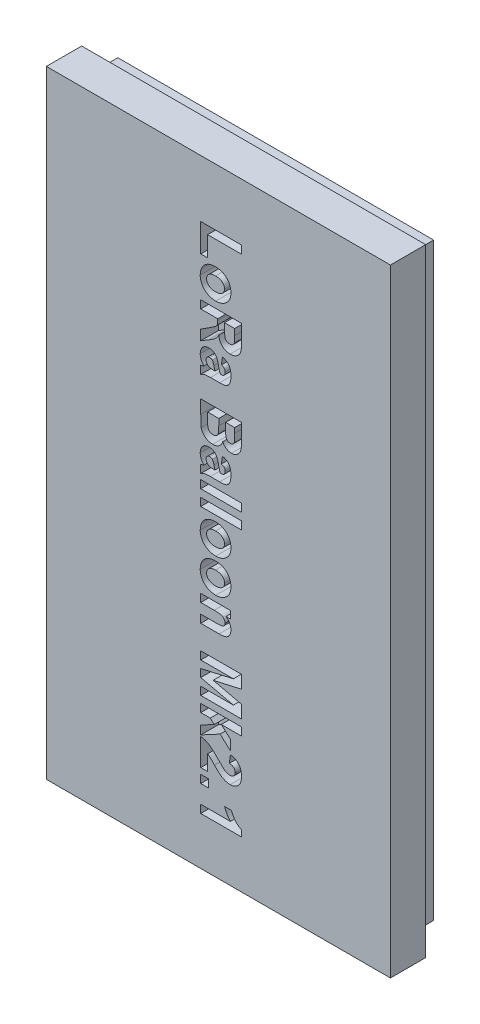
from build123d import *

# Parameters (mm, degrees)
SKETCH1_W           = 39
SKETCH1_H           = 70
BOSS_EXTRUDE1_DEPTH = 4
SKETCH2_W           = 35.8
SKETCH2_H           = 66.8
SKETCH2_W_2         = 32.2
SKETCH2_H_2         = 63.2
BOSS_EXTRUDE2_DEPTH = 2.5
SKETCH3_W           = 4.622973633
SKETCH3_H           = 0.90057928
SKETCH3_H_2         = 0.900579279
SKETCH3_W_2         = 0.900579279
CUT_EXTRUDE1_DEPTH  = 2


with BuildPart() as part:
    # Sketch1 → Boss-Extrude1 (new body)
    with BuildSketch(Plane.XY):
        with Locations((19.5, 35)):
            Rectangle(SKETCH1_W, SKETCH1_H)
    extrude(amount=BOSS_EXTRUDE1_DEPTH)

    # Sketch2 → Boss-Extrude2 (add)
    with BuildSketch(Plane(origin=(0, 0, 0), x_dir=(-1, 0, 0), z_dir=(0, 0, -1))):
        with Locations((-19.5, 35)):
            Rectangle(SKETCH2_W, SKETCH2_H)
        with Locations((-19.5, 35)):
            Rectangle(SKETCH2_W_2, SKETCH2_H_2, mode=Mode.SUBTRACT)
    extrude(amount=BOSS_EXTRUDE2_DEPTH)

    # Sketch3 → Cut-Extrude1 (cut)
    # profile 1 of 16: a face of its own
    with BuildSketch(Plane.XY.offset(4)):
        Polygon((17.5, 63.519691051), (22.122973633, 63.519691051), (22.122973633, 62.619111772), (18.280502042, 62.619111772), (18.280502042, 60.337644265), (17.5, 60.337644265), align=None)
    # profile 2 of 16: a face of its own
    with BuildSketch(Plane.XY.offset(4)):
        with BuildLine():
            add(Edge.make_bspline(
                [(19.227986492, 59.917373935), (19.268340591, 59.916553667), (19.348241235, 59.914929545), (19.466831788, 59.904980589), (19.582597294, 59.885571908), (19.695714536, 59.860482277), (19.806416527, 59.82895916), (19.913363069, 59.787668503), (20.018572563, 59.741561532), (20.119538873, 59.686551332), (20.216642118, 59.627238007), (20.307982668, 59.562480077), (20.392270804, 59.492505889), (20.471764649, 59.420003428), (20.542963196, 59.340819709), (20.610173753, 59.25914226), (20.668761487, 59.17106248), (20.722741328, 59.080281515), (20.769340893, 58.984958843), (20.810963092, 58.887212626), (20.84421655, 58.785501626), (20.874003462, 58.682243794), (20.895076066, 58.575124144), (20.911226693, 58.46559476), (20.920807626, 58.352789526), (20.921733394, 58.276648926), (20.922201261, 58.23816882)],
                knots=[0, 0, 0, 0, 1.087797627, 2.153826546, 3.204146119, 4.249074796, 5.276002369, 6.302929943, 7.33671768, 8.369955531, 9.399197913, 10.402506754, 11.384561342, 12.350717656, 13.299250364, 14.252266119, 15.199037181, 16.147307724, 17.097187567, 18.056740571, 19.008264324, 19.97962709, 20.951574749, 21.948063114, 22.962987564, 24, 24, 24, 24], degree=3))
            add(Edge.make_bspline(
                [(20.922201261, 58.23816882), (20.920492435, 58.17431076), (20.917163302, 58.049902547), (20.89380331, 57.868435741), (20.853287611, 57.69781183), (20.797267351, 57.536975467), (20.72326136, 57.38733444), (20.634810544, 57.247019053), (20.529143938, 57.117967528), (20.40795289, 57.001818049), (20.277240101, 56.897040623), (20.139130934, 56.806096419), (19.996080966, 56.728621147), (19.847473094, 56.665454644), (19.693540221, 56.615077456), (19.533372162, 56.581373883), (19.368435672, 56.5582934), (19.256523789, 56.556247491), (19.199843389, 56.555211293)],
                knots=[0, 0, 0, 0, 1.136040707, 2.213233445, 3.248238065, 4.25119704, 5.236487175, 6.211911138, 7.196384178, 8.195725979, 9.1931767, 10.173001403, 11.133846892, 12.083513917, 13.042376269, 14.010298635, 14.992269034, 16, 16, 16, 16], degree=3))
            add(Edge.make_bspline(
                [(19.199843389, 56.555211293), (19.157599655, 56.555892607), (19.0738988, 56.557242549), (18.949923499, 56.569225625), (18.828866965, 56.586435452), (18.710806659, 56.612233079), (18.595913097, 56.644512826), (18.484212787, 56.68553559), (18.375843769, 56.733219222), (18.270645012, 56.787374854), (18.171228883, 56.848385325), (18.076479739, 56.912829759), (17.989613644, 56.983498286), (17.908343846, 57.057930632), (17.833120613, 57.136653742), (17.764474284, 57.22039727), (17.702322369, 57.308790164), (17.647348245, 57.401571301), (17.598380596, 57.497418925), (17.556075444, 57.596143647), (17.52061437, 57.69714263), (17.49154767, 57.800282717), (17.4673821, 57.905319168), (17.452433072, 58.013337566), (17.441007522, 58.123164342), (17.440311587, 58.197173674), (17.439961381, 58.234416407)],
                knots=[0, 0, 0, 0, 1.117558833, 2.214307803, 3.293244786, 4.351421184, 5.409597582, 6.448807362, 7.497331125, 8.540978692, 9.576922014, 10.582241184, 11.570837346, 12.537122916, 13.496974449, 14.449450387, 15.399839374, 16.353464778, 17.300823134, 18.246083241, 19.193441597, 20.131138339, 21.080698472, 22.042616426, 23.015011865, 24, 24, 24, 24], degree=3))
            add(Edge.make_bspline(
                [(17.439961381, 58.234416407), (17.441434818, 58.293581477), (17.444329398, 58.409811804), (17.466190044, 58.580403837), (17.502637169, 58.743113282), (17.553836141, 58.89819662), (17.618260134, 59.046016275), (17.698440035, 59.185734774), (17.79447105, 59.316576164), (17.902499007, 59.440250702), (18.024251963, 59.553385074), (18.159878703, 59.651084335), (18.308067385, 59.733312239), (18.468125433, 59.800916368), (18.640780217, 59.853364958), (18.825794291, 59.890561403), (19.022910429, 59.913321598), (19.158504181, 59.916000953), (19.227986492, 59.917373935)],
                knots=[0, 0, 0, 0, 1.024594995, 2.012826322, 2.973358778, 3.908543225, 4.837401023, 5.761810751, 6.69243552, 7.644223827, 8.602462928, 9.564551743, 10.532007457, 11.531954493, 12.568505162, 13.651979317, 14.796803673, 16, 16, 16, 16], degree=3))
        make_face()
        with BuildLine():
            add(Edge.make_bspline(
                [(19.181081321, 59.016794656), (19.140418132, 59.015985767), (19.061457429, 59.014415049), (18.946509384, 59.004834622), (18.839622498, 58.985121553), (18.739486697, 58.962179728), (18.647961982, 58.928237045), (18.563118232, 58.889661344), (18.486368037, 58.842211129), (18.418159022, 58.787894592), (18.358227437, 58.728430958), (18.305063926, 58.666277416), (18.260023454, 58.601076499), (18.223835025, 58.532291004), (18.195763008, 58.46081815), (18.174765469, 58.386120438), (18.162389452, 58.308317825), (18.161082475, 58.255410656), (18.160424805, 58.228787786)],
                knots=[0, 0, 0, 0, 1.347985487, 2.617548842, 3.817114289, 4.948286482, 6.017057593, 7.046407217, 8.032969353, 8.999289909, 9.930051738, 10.827140183, 11.706817169, 12.550594062, 13.397420762, 14.247349517, 15.118066881, 16, 16, 16, 16], degree=3))
            add(Edge.make_bspline(
                [(18.160424805, 58.228787786), (18.161082172, 58.202789107), (18.162388524, 58.151123318), (18.174768649, 58.075184814), (18.195758212, 58.002347429), (18.224167513, 57.93213144), (18.260561859, 57.864498818), (18.306359128, 57.800600759), (18.359147439, 57.739085743), (18.42010437, 57.68129455), (18.488357165, 57.627164406), (18.565874129, 57.581398416), (18.650982245, 57.542984668), (18.743354127, 57.51120928), (18.843361939, 57.485665346), (18.951359004, 57.468256351), (19.067059726, 57.458032174), (19.146662829, 57.456552441), (19.187648045, 57.455790572)],
                knots=[0, 0, 0, 0, 0.86498205, 1.718932724, 2.552529207, 3.383717481, 4.236080589, 5.102502034, 5.995588818, 6.930639414, 7.894730959, 8.889086482, 9.918564038, 10.998334367, 12.1369617, 13.350269694, 14.635734454, 16, 16, 16, 16], degree=3))
            add(Edge.make_bspline(
                [(19.187648045, 57.455790572), (19.227688932, 57.456588782), (19.305407142, 57.458138086), (19.418448526, 57.467853118), (19.523973479, 57.487150925), (19.622320571, 57.511914829), (19.713524667, 57.543985128), (19.797316766, 57.58327715), (19.873991238, 57.630272105), (19.942107737, 57.685034462), (20.003044034, 57.743795675), (20.055828048, 57.806243808), (20.101619145, 57.87108965), (20.138009283, 57.939653741), (20.166408615, 58.010806032), (20.187393837, 58.084578407), (20.199774112, 58.161447567), (20.201080471, 58.21373417), (20.201737837, 58.240045027)],
                knots=[0, 0, 0, 0, 1.337232047, 2.595528913, 3.783536199, 4.915617704, 5.97906533, 7.006690339, 8.000659516, 8.974235141, 9.919454987, 10.823278711, 11.700968276, 12.565199868, 13.408680491, 14.254935835, 15.121875735, 16, 16, 16, 16], degree=3))
            add(Edge.make_bspline(
                [(20.201737837, 58.240045027), (20.201125638, 58.266363218), (20.199923414, 58.318046388), (20.187117275, 58.394207937), (20.1666105, 58.467170456), (20.137959369, 58.53762355), (20.10165055, 58.605310335), (20.055496899, 58.669222471), (20.003354012, 58.731596732), (19.942036507, 58.789412202), (19.873587127, 58.843503766), (19.796542842, 58.889985729), (19.712370979, 58.929796557), (19.620397249, 58.961484494), (19.521262796, 58.98667956), (19.414268616, 59.004448634), (19.300102491, 59.014500587), (19.221439565, 59.016016772), (19.181081321, 59.016794656)],
                knots=[0, 0, 0, 0, 0.8777483, 1.723705717, 2.56959874, 3.403036217, 4.257705828, 5.126471818, 6.029908573, 6.967489424, 7.934189811, 8.936630112, 9.963815147, 11.036651848, 12.178360317, 13.374360467, 14.652907978, 16, 16, 16, 16], degree=3))
        make_face(mode=Mode.SUBTRACT)
    # profile 3 of 16: a face of its own
    with BuildSketch(Plane.XY.offset(4)):
        with BuildLine():
            Line((17.5, 55.834747869), (22.122973633, 55.834747869))
            Line((22.122973633, 55.834747869), (22.122973633, 53.931336039))
            add(Edge.make_bspline(
                [(22.122973633, 53.931336039), (22.122603462, 53.872546069), (22.121890503, 53.759314846), (22.116763364, 53.595968956), (22.105883787, 53.445890968), (22.093695487, 53.308683291), (22.075788291, 53.184747794), (22.054389036, 53.07355638), (22.02973767, 52.975250916), (21.991190656, 52.86232027), (21.927918547, 52.73590191), (21.829831137, 52.599074998), (21.709116511, 52.475953385), (21.591346034, 52.386968918), (21.487257539, 52.325280846), (21.404923358, 52.283439484), (21.317857299, 52.250098354), (21.227356033, 52.221689731), (21.133020602, 52.199279165), (21.034598303, 52.183293809), (20.932711672, 52.173783072), (20.863433738, 52.17285937), (20.828390919, 52.172392134)],
                knots=[0, 0, 0, 0, 1.403336213, 2.702867097, 3.89994726, 4.994709233, 5.990128961, 6.887471613, 7.696701944, 8.407207329, 9.732421867, 11.053910544, 12.410433107, 13.833109191, 14.562763883, 15.297137368, 16.03453921, 16.78526912, 17.560138056, 18.346710252, 19.163717375, 20, 20, 20, 20], degree=3))
            add(Edge.make_bspline(
                [(20.828390919, 52.172392134), (20.784249276, 52.173152122), (20.697885971, 52.17463904), (20.571821786, 52.19038499), (20.45195708, 52.21403639), (20.339297604, 52.249508681), (20.231984451, 52.291952276), (20.132497639, 52.347135765), (20.039105913, 52.411113631), (19.952432097, 52.48444969), (19.87351831, 52.567423037), (19.802330467, 52.658794234), (19.737810759, 52.757581763), (19.682936532, 52.865615406), (19.633581682, 52.98093702), (19.593807931, 53.105487545), (19.560681473, 53.237717693), (19.545373295, 53.32925955), (19.537560619, 53.375978817)],
                knots=[0, 0, 0, 0, 1.084141299, 2.12112686, 3.117250271, 4.082180618, 5.019674211, 5.948149429, 6.871043381, 7.797863675, 8.732676681, 9.679570512, 10.640822351, 11.627176691, 12.653315453, 13.72007994, 14.836420889, 16, 16, 16, 16], degree=3))
            add(Edge.make_bspline(
                [(19.537560619, 53.375978817), (19.508484087, 53.327420021), (19.451853997, 53.232845847), (19.358336472, 53.100939278), (19.261317569, 52.981707751), (19.174212653, 52.890871561), (19.097310292, 52.821625001), (19.0295238, 52.766448195), (18.951540268, 52.707420675), (18.862838653, 52.644481945), (18.763722605, 52.577189453), (18.653874446, 52.505987708), (18.533375015, 52.430769254), (18.449117336, 52.379912075), (18.405269796, 52.353446093)],
                knots=[0, 0, 0, 0, 1.316447784, 2.563942512, 3.758196669, 4.89017242, 5.487731481, 6.164970468, 6.923081098, 7.76291089, 8.695186333, 9.710230341, 10.808408125, 12, 12, 12, 12], degree=3))
            Line((18.405269796, 52.353446093), (17.5, 51.812160423))
            Line((17.5, 51.812160423), (17.5, 52.95383228))
            Line((17.5, 52.95383228), (18.495327724, 53.594556913))
            add(Edge.make_bspline(
                [(18.495327724, 53.594556913), (18.538170903, 53.622381996), (18.619855584, 53.675433219), (18.736113095, 53.751052306), (18.839709613, 53.820173631), (18.931509766, 53.880939595), (19.009413932, 53.937271757), (19.075916224, 53.984397728), (19.12987976, 54.024862821), (19.184272621, 54.068912267), (19.238866246, 54.121356183), (19.293796286, 54.18457256), (19.336920929, 54.250578408), (19.370530988, 54.321019242), (19.39451614, 54.403545626), (19.410428062, 54.503019432), (19.418952624, 54.622883951), (19.420435996, 54.709323008), (19.421235795, 54.755928941)],
                knots=[0, 0, 0, 0, 1.540630534, 2.937361724, 4.182336204, 5.296545873, 6.256860607, 7.081241145, 7.754565199, 8.290682583, 9.191113071, 10.033949391, 10.810788607, 11.561665679, 12.379113064, 13.39303176, 14.594383257, 16, 16, 16, 16], degree=3))
            Line((19.421235795, 54.755928941), (19.421235795, 54.93416859))
            Line((19.421235795, 54.93416859), (17.5, 54.93416859))
            Line((17.5, 54.93416859), (17.5, 55.834747869))
        make_face()
        with BuildLine():
            Line((20.201737837, 54.93416859), (20.201737837, 54.273743786))
            add(Edge.make_bspline(
                [(20.201737837, 54.273743786), (20.201999563, 54.225587847), (20.20249754, 54.133962899), (20.203997976, 54.003230593), (20.207918581, 53.886279269), (20.212519213, 53.783074596), (20.217812844, 53.693574506), (20.224943188, 53.617787775), (20.23420104, 53.555806365), (20.24734485, 53.49201719), (20.271407064, 53.424655662), (20.311858966, 53.353327902), (20.361639607, 53.288286701), (20.424349944, 53.232785424), (20.498156922, 53.186888836), (20.583996569, 53.155374934), (20.680596319, 53.136459226), (20.748558268, 53.134198807), (20.784300059, 53.133010032)],
                knots=[0, 0, 0, 0, 1.560937284, 2.96995135, 4.237567709, 5.353650601, 6.318464703, 7.143454388, 7.820048429, 8.348858403, 9.25293029, 10.124191563, 10.998043079, 11.895328271, 12.823620657, 13.798761283, 14.842349086, 16, 16, 16, 16], degree=3))
            add(Edge.make_bspline(
                [(20.784300059, 53.133010032), (20.81847221, 53.134245883), (20.883936766, 53.136613436), (20.976941065, 53.155158092), (21.059506611, 53.187182262), (21.130758936, 53.23301968), (21.191421011, 53.289971409), (21.24112854, 53.356768373), (21.282982152, 53.431399448), (21.299994907, 53.486582477), (21.308699868, 53.514818122)],
                knots=[0, 0, 0, 0, 1.164311867, 2.230505154, 3.21629184, 4.165493112, 5.100643873, 6.036584124, 6.995373831, 8, 8, 8, 8], degree=3))
            add(Edge.make_bspline(
                [(21.308699868, 53.514818122), (21.311320199, 53.527617067), (21.317551044, 53.558051486), (21.324877556, 53.611570435), (21.329832618, 53.679873062), (21.334583807, 53.762748434), (21.338086886, 53.860333551), (21.341182461, 53.972906446), (21.341427788, 54.100196665), (21.342111742, 54.189940649), (21.342471591, 54.237157752)],
                knots=[0, 0, 0, 0, 0.432971861, 1.029557334, 1.788740938, 2.702316591, 3.781055348, 5.025222918, 6.434877167, 8, 8, 8, 8], degree=3))
            Line((21.342471591, 54.237157752), (21.342471591, 54.93416859))
            Line((21.342471591, 54.93416859), (20.201737837, 54.93416859))
        make_face(mode=Mode.SUBTRACT)
    # profile 4 of 16: a face of its own
    with BuildSketch(Plane.XY.offset(4)):
        with BuildLine():
            Line((19.841506126, 50.61138805), (19.961583363, 51.451928711))
            add(Edge.make_bspline(
                [(19.961583363, 51.451928711), (20.003056427, 51.440020111), (20.08373433, 51.416854211), (20.198162111, 51.373136266), (20.30438426, 51.325709527), (20.401073835, 51.270902191), (20.489620864, 51.211489282), (20.568113139, 51.144980211), (20.637964286, 51.07344571), (20.699606916, 50.99601388), (20.752828321, 50.910954703), (20.798705368, 50.817942481), (20.837141958, 50.716108782), (20.867740873, 50.60578658), (20.892075182, 50.486988816), (20.909807303, 50.359486045), (20.919932697, 50.223177629), (20.921430674, 50.129532389), (20.922201261, 50.081359621)],
                knots=[0, 0, 0, 0, 1.125515524, 2.189474865, 3.193709533, 4.158305409, 5.086274303, 5.972285183, 6.837881566, 7.691743787, 8.549806887, 9.451203831, 10.393874208, 11.385866739, 12.435713252, 13.556277782, 14.742906037, 16, 16, 16, 16], degree=3))
            add(Edge.make_bspline(
                [(20.922201261, 50.081359621), (20.921986052, 50.038506543), (20.921567926, 49.9552477), (20.914195236, 49.834230246), (20.905701633, 49.720830457), (20.891648419, 49.615270623), (20.872802431, 49.517635474), (20.850656262, 49.42762641), (20.824366297, 49.345482), (20.785361186, 49.248588079), (20.72686919, 49.141789781), (20.645227411, 49.029792983), (20.550150903, 48.93865795), (20.460504459, 48.877402987), (20.378336951, 48.83955966), (20.305144759, 48.816000272), (20.220833774, 48.79526852), (20.12519058, 48.778860098), (20.01811083, 48.765903154), (19.899799318, 48.756781831), (19.770265296, 48.75115149), (19.680158536, 48.750519763), (19.633247167, 48.750190874)],
                knots=[0, 0, 0, 0, 1.172645795, 2.278322549, 3.317437237, 4.284552983, 5.190951134, 6.037858116, 6.820064311, 7.549551753, 8.893788561, 10.141635195, 11.328036199, 12.481663495, 13.094362176, 13.79803918, 14.582676335, 15.469136844, 16.45214095, 17.533908717, 18.716103928, 20, 20, 20, 20], degree=3))
            Line((19.633247167, 48.750190874), (18.599457203, 48.757695701))
            add(Edge.make_bspline(
                [(18.599457203, 48.757695701), (18.564435728, 48.757403719), (18.496576972, 48.756837966), (18.398330909, 48.755681196), (18.307040045, 48.750474743), (18.222621106, 48.744792865), (18.144878475, 48.739106667), (18.074326469, 48.729015709), (18.010639761, 48.719369923), (17.934153527, 48.702680168), (17.841504636, 48.67487694), (17.729923806, 48.631472915), (17.614669352, 48.576902525), (17.539082625, 48.532826305), (17.5, 48.510036399)],
                knots=[0, 0, 0, 0, 1.100960395, 2.13325684, 3.08799504, 3.974623839, 4.793377983, 5.537123068, 6.214225653, 6.817686965, 7.996461938, 9.250537039, 10.578371695, 12, 12, 12, 12], degree=3))
            Line((17.5, 48.510036399), (17.5, 49.410615678))
            Line((17.5, 49.410615678), (17.867736539, 49.520373778))
            add(Edge.make_bspline(
                [(17.867736539, 49.520373778), (17.83226304, 49.556591272), (17.763238807, 49.627063168), (17.674416477, 49.742170854), (17.599695505, 49.860344522), (17.540260444, 49.983200312), (17.494849843, 50.10999856), (17.463178517, 50.240511108), (17.443827041, 50.375032633), (17.441261018, 50.465917722), (17.439961381, 50.511949088)],
                knots=[0, 0, 0, 0, 1.094238684, 2.129166538, 3.133671034, 4.10942336, 5.070833053, 6.037377746, 7.005973528, 8, 8, 8, 8], degree=3))
            add(Edge.make_bspline(
                [(17.439961381, 50.511949088), (17.441007341, 50.549813025), (17.443061457, 50.624172367), (17.454903777, 50.733206179), (17.476538098, 50.836821689), (17.507054288, 50.934832823), (17.543951561, 51.028430924), (17.591661801, 51.116031558), (17.646964549, 51.198837941), (17.71053094, 51.275834447), (17.781922723, 51.344520407), (17.857738316, 51.406912183), (17.941277911, 51.456774609), (18.028844016, 51.500371802), (18.123266364, 51.531264195), (18.222597532, 51.555303125), (18.327631273, 51.569376344), (18.399600412, 51.571119046), (18.436227209, 51.572005948)],
                knots=[0, 0, 0, 0, 1.111028414, 2.181900458, 3.212888925, 4.21115239, 5.190734394, 6.159429897, 7.131421471, 8.108723925, 9.081883785, 10.034678926, 10.981892532, 11.929727932, 12.898727489, 13.888948844, 14.925636122, 16, 16, 16, 16], degree=3))
            add(Edge.make_bspline(
                [(18.436227209, 51.572005948), (18.482593242, 51.570570747), (18.572724924, 51.567780835), (18.703283791, 51.545991429), (18.824622959, 51.509589158), (18.936022841, 51.457337912), (19.037479655, 51.39257465), (19.129142785, 51.315722556), (19.208842276, 51.225745591), (19.267148448, 51.141322735), (19.309753926, 51.065822541), (19.338835724, 50.999600706), (19.369441505, 50.926842835), (19.396985309, 50.845322297), (19.425368881, 50.756348095), (19.452494502, 50.659084561), (19.4774731, 50.553428176), (19.493569489, 50.48038811), (19.501912689, 50.442529436)],
                knots=[0, 0, 0, 0, 1.294162278, 2.515743014, 3.684113667, 4.820865117, 5.939906549, 7.036651616, 8.149715676, 9.285662014, 9.895437351, 10.567486448, 11.303637924, 12.098932185, 12.968810962, 13.91153998, 14.917493754, 16, 16, 16, 16], degree=3))
            add(Edge.make_bspline(
                [(19.501912689, 50.442529436), (19.511407002, 50.396831191), (19.529650374, 50.309021778), (19.559131352, 50.183149311), (19.587017816, 50.068002884), (19.61413993, 49.963436659), (19.640930358, 49.869757609), (19.668501435, 49.787074691), (19.694085633, 49.714833804), (19.712787099, 49.671017361), (19.721428888, 49.650770153)],
                knots=[0, 0, 0, 0, 1.361164628, 2.615484881, 3.770095419, 4.816364149, 5.765912261, 6.610903979, 7.358110453, 8, 8, 8, 8], degree=3))
            add(Edge.make_bspline(
                [(19.721428888, 49.650770153), (19.76207844, 49.651429427), (19.835936364, 49.652627291), (19.93546068, 49.657961407), (20.012171286, 49.66950181), (20.070146149, 49.685642352), (20.113156329, 49.712229682), (20.150196809, 49.74408205), (20.18179134, 49.785492699), (20.210776693, 49.83420177), (20.234039299, 49.892955807), (20.250744994, 49.962036374), (20.259418855, 50.041742371), (20.260957962, 50.098226609), (20.261776456, 50.128264791)],
                knots=[0, 0, 0, 0, 1.704637254, 3.09722893, 4.172654963, 4.956246112, 5.596985007, 6.275246559, 6.99385986, 7.769515704, 8.645866914, 9.631493719, 10.740434052, 12, 12, 12, 12], degree=3))
            add(Edge.make_bspline(
                [(20.261776456, 50.128264791), (20.260884607, 50.159017067), (20.25919465, 50.217289276), (20.241526382, 50.299374461), (20.215410217, 50.372126763), (20.174002857, 50.43472478), (20.117664666, 50.489569205), (20.042764104, 50.536922131), (19.949087652, 50.578793394), (19.879011929, 50.60002468), (19.841506126, 50.61138805)],
                knots=[0, 0, 0, 0, 1.045871977, 1.981813381, 2.848317391, 3.663751395, 4.514929533, 5.507645304, 6.666046366, 8, 8, 8, 8], degree=3))
        make_face()
        with BuildLine():
            add(Edge.make_bspline(
                [(19.121042702, 49.650770153), (19.111478433, 49.678227344), (19.090198568, 49.739317777), (19.059474829, 49.841940313), (19.027018533, 49.965053874), (19.005193715, 50.054117219), (18.993460638, 50.101997896)],
                knots=[0, 0, 0, 0, 0.743632693, 1.654533494, 2.73907137, 4, 4, 4, 4], degree=3))
            add(Edge.make_bspline(
                [(18.993460638, 50.101997896), (18.98653897, 50.130215888), (18.97332241, 50.184096661), (18.950053418, 50.260430744), (18.928514853, 50.329717913), (18.904326783, 50.390991339), (18.881777826, 50.445420249), (18.857166421, 50.491799098), (18.832210074, 50.530622659), (18.813567384, 50.552457403), (18.804901851, 50.562606673)],
                knots=[0, 0, 0, 0, 1.388607462, 2.65147299, 3.814389992, 4.855436495, 5.799565367, 6.62877246, 7.362623276, 8, 8, 8, 8], degree=3))
            add(Edge.make_bspline(
                [(18.804901851, 50.562606673), (18.787150786, 50.579491216), (18.752087496, 50.612842884), (18.686643373, 50.646727282), (18.614581201, 50.668200293), (18.563658271, 50.670332939), (18.537542378, 50.671426669)],
                knots=[0, 0, 0, 0, 0.985740837, 1.947112291, 2.947173789, 4, 4, 4, 4], degree=3))
            add(Edge.make_bspline(
                [(18.537542378, 50.671426669), (18.50766342, 50.670137856), (18.449801672, 50.667642019), (18.366786442, 50.643682117), (18.290760217, 50.606342092), (18.224593068, 50.553149627), (18.168585191, 50.490429239), (18.129814521, 50.416483471), (18.103890852, 50.33606052), (18.101569181, 50.279194172), (18.100386186, 50.250218235)],
                knots=[0, 0, 0, 0, 1.056198986, 2.045369905, 3.036276429, 4.038084886, 5.035473036, 5.992159802, 6.976916006, 8, 8, 8, 8], degree=3))
            add(Edge.make_bspline(
                [(18.100386186, 50.250218235), (18.101736527, 50.223223501), (18.104453435, 50.16890965), (18.124157539, 50.087854462), (18.156784545, 50.007731894), (18.200051148, 49.929484378), (18.252073425, 49.8576195), (18.311090427, 49.79663157), (18.374225547, 49.747093123), (18.432190619, 49.715163813), (18.484079963, 49.69628429), (18.530121172, 49.684823766), (18.5827991, 49.672932093), (18.642798398, 49.665245914), (18.709733915, 49.658557856), (18.78390109, 49.654068826), (18.865230729, 49.651253864), (18.921849407, 49.650935466), (18.951245984, 49.650770153)],
                knots=[0, 0, 0, 0, 1.093500888, 2.200141778, 3.360346716, 4.591280596, 5.815607582, 6.94487563, 8.019710678, 9.057444999, 9.610729159, 10.253199895, 10.979011171, 11.798077413, 12.702238226, 13.705425431, 14.808650418, 16, 16, 16, 16], degree=3))
            Line((18.951245984, 49.650770153), (19.121042702, 49.650770153))
        make_face(mode=Mode.SUBTRACT)
    # profile 5 of 16: a face of its own
    with BuildSketch(Plane.XY.offset(4)):
        with BuildLine():
            Line((22.122973633, 46.108491655), (22.122973633, 44.281066201))
            add(Edge.make_bspline(
                [(22.122973633, 44.281066201), (22.122521051, 44.221026579), (22.121651102, 44.105618856), (22.117632998, 43.939162972), (22.108005759, 43.786847256), (22.095757541, 43.648294778), (22.081840746, 43.523482495), (22.061533426, 43.412540908), (22.040180572, 43.315039471), (22.0049456, 43.204537428), (21.948462842, 43.080188598), (21.859088002, 42.944827325), (21.748544411, 42.821243994), (21.640427701, 42.730695394), (21.545807025, 42.665898527), (21.471963858, 42.622291391), (21.394724771, 42.586831753), (21.315529677, 42.557950869), (21.2346417, 42.533594529), (21.150572045, 42.51855641), (21.064475175, 42.507225139), (21.006044505, 42.506526476), (20.976611259, 42.506174538)],
                knots=[0, 0, 0, 0, 1.498327689, 2.88007457, 4.154414764, 5.305986542, 6.351317343, 7.286582663, 8.11946184, 8.840080679, 10.177555878, 11.512935148, 12.872513647, 14.301275782, 15.019863751, 15.733221227, 16.438466007, 17.137161526, 17.836031326, 18.543086972, 19.26611006, 20, 20, 20, 20], degree=3))
            add(Edge.make_bspline(
                [(20.976611259, 42.506174538), (20.922946761, 42.508244761), (20.817024149, 42.512330951), (20.662821857, 42.547652419), (20.51596526, 42.603079791), (20.380113254, 42.682270405), (20.256588311, 42.778484715), (20.148778926, 42.889289753), (20.056681459, 43.012718845), (20.011500867, 43.104508485), (19.988788362, 43.150651585)],
                knots=[0, 0, 0, 0, 1.031817477, 2.036594177, 3.029254201, 4.043130586, 5.050931669, 6.034203586, 7.01178454, 8, 8, 8, 8], degree=3))
            add(Edge.make_bspline(
                [(19.988788362, 43.150651585), (19.978291223, 43.119218071), (19.957542489, 43.057086323), (19.919057509, 42.967929238), (19.874445181, 42.88431553), (19.826159834, 42.80476423), (19.770442173, 42.731859613), (19.709973461, 42.664103109), (19.645321829, 42.600321355), (19.573797837, 42.544037104), (19.499063042, 42.491579361), (19.418797393, 42.447838091), (19.335071516, 42.410185621), (19.247401209, 42.378753037), (19.155229507, 42.355750252), (19.059306459, 42.33888402), (18.959608937, 42.328333414), (18.891858621, 42.326825057), (18.857435643, 42.326058683)],
                knots=[0, 0, 0, 0, 1.053917501, 2.08318216, 3.084375989, 4.067115349, 5.039987852, 5.998256831, 6.954975631, 7.924383767, 8.890110205, 9.856297623, 10.826929889, 11.808561028, 12.814635272, 13.844956918, 14.905053061, 16, 16, 16, 16], degree=3))
            add(Edge.make_bspline(
                [(18.857435643, 42.326058683), (18.815500063, 42.327003794), (18.733295748, 42.328856452), (18.612472135, 42.342119765), (18.496620731, 42.364499356), (18.385911071, 42.396523304), (18.279951486, 42.436913818), (18.179119697, 42.486864589), (18.083315073, 42.546315283), (17.992730779, 42.613589789), (17.90919217, 42.686948542), (17.833589227, 42.76465437), (17.765489185, 42.844869725), (17.707581308, 42.930073546), (17.656528591, 43.017258222), (17.61374927, 43.107736452), (17.581005615, 43.201992388), (17.565164633, 43.26652488), (17.557224308, 43.298871925)],
                knots=[0, 0, 0, 0, 1.145607172, 2.24567906, 3.316329682, 4.365460088, 5.390414304, 6.410550385, 7.434792233, 8.46684308, 9.489944109, 10.468671886, 11.426900475, 12.36059261, 13.279351643, 14.185149476, 15.09030244, 16, 16, 16, 16], degree=3))
            add(Edge.make_bspline(
                [(17.557224308, 43.298871925), (17.552629506, 43.325417983), (17.542179673, 43.385790953), (17.530238938, 43.48844883), (17.521967062, 43.613706564), (17.512784829, 43.761568824), (17.508239794, 43.932081832), (17.503113461, 44.125314849), (17.500511164, 44.34109826), (17.500175925, 44.492451827), (17.5, 44.57187826)],
                knots=[0, 0, 0, 0, 0.506837559, 1.152686718, 1.943271314, 2.868501158, 3.939884368, 5.152247396, 6.505573166, 8, 8, 8, 8], degree=3))
            Line((17.5, 44.57187826), (17.5, 46.108491655))
            Line((17.5, 46.108491655), (22.122973633, 46.108491655))
        make_face()
        with BuildLine():
            Line((21.342471591, 45.207912376), (20.321815075, 45.207912376))
            Line((20.321815075, 45.207912376), (20.321815075, 44.594392742))
            add(Edge.make_bspline(
                [(20.321815075, 44.594392742), (20.321708304, 44.55061401), (20.321505436, 44.467433178), (20.322860414, 44.349236777), (20.323271951, 44.244155796), (20.325612076, 44.152236417), (20.326868369, 44.073713296), (20.330184865, 44.008391975), (20.332255296, 43.956085536), (20.33545221, 43.925515906), (20.336824729, 43.912391559)],
                knots=[0, 0, 0, 0, 1.539755574, 2.925579234, 4.157432792, 5.235486124, 6.159601295, 6.919197766, 7.535983151, 8, 8, 8, 8], degree=3))
            add(Edge.make_bspline(
                [(20.336824729, 43.912391559), (20.342990913, 43.874641455), (20.354742688, 43.802695703), (20.388025395, 43.701846174), (20.433788831, 43.614182948), (20.491801151, 43.538937987), (20.562445267, 43.478974229), (20.646094328, 43.436974564), (20.740542137, 43.410987644), (20.807575483, 43.408203042), (20.84246247, 43.406753817)],
                knots=[0, 0, 0, 0, 1.156043088, 2.203236031, 3.197816213, 4.134692963, 5.061434266, 5.975433912, 6.946330216, 8, 8, 8, 8], degree=3))
            add(Edge.make_bspline(
                [(20.84246247, 43.406753817), (20.873876263, 43.407765583), (20.934019538, 43.409702659), (21.019351721, 43.431386426), (21.096016804, 43.464879192), (21.161935885, 43.513564177), (21.216357618, 43.571749905), (21.262093272, 43.635170819), (21.293723027, 43.705544152), (21.3117268, 43.770575939), (21.321477076, 43.833977643), (21.325841476, 43.900183126), (21.332380205, 43.98452942), (21.334869957, 44.08688744), (21.339580253, 44.207545593), (21.340377663, 44.346113349), (21.343094236, 44.5027625), (21.342686451, 44.613153063), (21.342471591, 44.671317222)],
                knots=[0, 0, 0, 0, 0.973031789, 1.862917975, 2.714444411, 3.555113712, 4.385861934, 5.180259999, 5.970734499, 6.766732084, 7.267820327, 7.959442945, 8.825288207, 9.893716152, 11.136763095, 12.573466007, 14.194578749, 16, 16, 16, 16], degree=3))
            Line((21.342471591, 44.671317222), (21.342471591, 45.207912376))
        make_face(mode=Mode.SUBTRACT)
        with BuildLine():
            Line((19.541313033, 45.207912376), (18.280502042, 45.207912376))
            Line((18.280502042, 45.207912376), (18.280502042, 44.367371715))
            add(Edge.make_bspline(
                [(18.280502042, 44.367371715), (18.280760428, 44.323280795), (18.281253401, 44.239160195), (18.282800025, 44.11937151), (18.286518536, 44.01209175), (18.291887116, 43.916971468), (18.299557696, 43.834126401), (18.307251331, 43.763556455), (18.317857629, 43.70572466), (18.331738252, 43.644979433), (18.35944942, 43.580071948), (18.402845831, 43.510176577), (18.458232543, 43.446158643), (18.525607831, 43.390276991), (18.604204685, 43.343759319), (18.693207476, 43.30987147), (18.79246554, 43.290066164), (18.861720576, 43.287837041), (18.897774089, 43.28667658)],
                knots=[0, 0, 0, 0, 1.468823539, 2.802352852, 3.990613231, 5.044577628, 5.97542194, 6.762296442, 7.407977832, 7.933490854, 8.834961323, 9.742609811, 10.665728169, 11.642033707, 12.646065455, 13.694610711, 14.799836276, 16, 16, 16, 16], degree=3))
            add(Edge.make_bspline(
                [(18.897774089, 43.28667658), (18.93476601, 43.288172532), (19.005924698, 43.291050187), (19.107872413, 43.311463924), (19.199388257, 43.34738452), (19.279963622, 43.397906582), (19.349625379, 43.459908308), (19.407243483, 43.532310286), (19.454309014, 43.613210713), (19.482516024, 43.689669667), (19.49973763, 43.760283467), (19.510234486, 43.826232908), (19.521102124, 43.904014), (19.527554048, 43.994593036), (19.534829997, 44.097100853), (19.5376358, 44.212266537), (19.540957195, 44.339522346), (19.541190876, 44.42865785), (19.541313033, 44.475253608)],
                knots=[0, 0, 0, 0, 1.143215143, 2.19912046, 3.197116365, 4.165365694, 5.123819291, 6.065802965, 7.014162653, 8.005206416, 8.5725482, 9.259043701, 10.068343003, 10.999502645, 12.064921609, 13.244816419, 14.559722402, 16, 16, 16, 16], degree=3))
            Line((19.541313033, 44.475253608), (19.541313033, 45.207912376))
        make_face(mode=Mode.SUBTRACT)
    # profile 6 of 16: a face of its own
    with BuildSketch(Plane.XY.offset(4)):
        with BuildLine():
            Line((19.841506126, 40.885131836), (19.961583363, 41.725672496))
            add(Edge.make_bspline(
                [(19.961583363, 41.725672496), (20.003056427, 41.713763896), (20.08373433, 41.690597996), (20.198162111, 41.646880052), (20.30438426, 41.599453313), (20.401073835, 41.544645976), (20.489620864, 41.485233068), (20.568113139, 41.418723997), (20.637964286, 41.347189496), (20.699606916, 41.269757665), (20.752828321, 41.184698488), (20.798705368, 41.091686266), (20.837141958, 40.989852568), (20.867740873, 40.879530366), (20.892075182, 40.760732601), (20.909807303, 40.633229831), (20.919932697, 40.496921414), (20.921430674, 40.403276175), (20.922201261, 40.355103406)],
                knots=[0, 0, 0, 0, 1.125515524, 2.189474865, 3.193709533, 4.158305409, 5.086274303, 5.972285183, 6.837881566, 7.691743787, 8.549806887, 9.451203831, 10.393874208, 11.385866739, 12.435713252, 13.556277782, 14.742906037, 16, 16, 16, 16], degree=3))
            add(Edge.make_bspline(
                [(20.922201261, 40.355103406), (20.921986052, 40.312250329), (20.921567926, 40.228991485), (20.914195236, 40.107974031), (20.905701633, 39.994574243), (20.891648419, 39.889014409), (20.872802431, 39.79137926), (20.850656262, 39.701370195), (20.824366297, 39.619225785), (20.785361186, 39.522331864), (20.72686919, 39.415533566), (20.645227411, 39.303536769), (20.550150903, 39.212401735), (20.460504459, 39.151146773), (20.378336951, 39.113303446), (20.305144759, 39.089744058), (20.220833774, 39.069012306), (20.12519058, 39.052603883), (20.01811083, 39.039646939), (19.899799318, 39.030525616), (19.770265296, 39.024895276), (19.680158536, 39.024263549), (19.633247167, 39.023934659)],
                knots=[0, 0, 0, 0, 1.172645795, 2.278322549, 3.317437237, 4.284552983, 5.190951134, 6.037858116, 6.820064311, 7.549551753, 8.893788561, 10.141635195, 11.328036199, 12.481663495, 13.094362176, 13.79803918, 14.582676335, 15.469136844, 16.45214095, 17.533908717, 18.716103928, 20, 20, 20, 20], degree=3))
            Line((19.633247167, 39.023934659), (18.599457203, 39.031439486))
            add(Edge.make_bspline(
                [(18.599457203, 39.031439486), (18.564435728, 39.031147505), (18.496576972, 39.030581752), (18.398330909, 39.029424982), (18.307040045, 39.024218529), (18.222621106, 39.01853665), (18.144878475, 39.012850452), (18.074326469, 39.002759494), (18.010639761, 38.993113708), (17.934153527, 38.976423954), (17.841504636, 38.948620726), (17.729923806, 38.9052167), (17.614669352, 38.85064631), (17.539082625, 38.80657009), (17.5, 38.783780185)],
                knots=[0, 0, 0, 0, 1.100960395, 2.13325684, 3.08799504, 3.974623839, 4.793377983, 5.537123068, 6.214225653, 6.817686965, 7.996461938, 9.250537039, 10.578371695, 12, 12, 12, 12], degree=3))
            Line((17.5, 38.783780185), (17.5, 39.684359464))
            Line((17.5, 39.684359464), (17.867736539, 39.794117563))
            add(Edge.make_bspline(
                [(17.867736539, 39.794117563), (17.83226304, 39.830335057), (17.763238807, 39.900806954), (17.674416477, 40.015914639), (17.599695505, 40.134088308), (17.540260444, 40.256944098), (17.494849843, 40.383742345), (17.463178517, 40.514254893), (17.443827041, 40.648776419), (17.441261018, 40.739661508), (17.439961381, 40.785692874)],
                knots=[0, 0, 0, 0, 1.094238684, 2.129166538, 3.133671034, 4.10942336, 5.070833053, 6.037377746, 7.005973528, 8, 8, 8, 8], degree=3))
            add(Edge.make_bspline(
                [(17.439961381, 40.785692874), (17.441007341, 40.823556811), (17.443061457, 40.897916153), (17.454903777, 41.006949964), (17.476538098, 41.110565475), (17.507054288, 41.208576608), (17.543951561, 41.30217471), (17.591661801, 41.389775344), (17.646964549, 41.472581727), (17.71053094, 41.549578232), (17.781922723, 41.618264192), (17.857738316, 41.680655968), (17.941277911, 41.730518394), (18.028844016, 41.774115587), (18.123266364, 41.80500798), (18.222597532, 41.82904691), (18.327631273, 41.84312013), (18.399600412, 41.844862831), (18.436227209, 41.845749734)],
                knots=[0, 0, 0, 0, 1.111028414, 2.181900458, 3.212888925, 4.21115239, 5.190734394, 6.159429897, 7.131421471, 8.108723925, 9.081883785, 10.034678926, 10.981892532, 11.929727932, 12.898727489, 13.888948844, 14.925636122, 16, 16, 16, 16], degree=3))
            add(Edge.make_bspline(
                [(18.436227209, 41.845749734), (18.482593242, 41.844314532), (18.572724924, 41.841524621), (18.703283791, 41.819735215), (18.824622959, 41.783332943), (18.936022841, 41.731081698), (19.037479655, 41.666318435), (19.129142785, 41.589466341), (19.208842276, 41.499489376), (19.267148448, 41.41506652), (19.309753926, 41.339566327), (19.338835724, 41.273344491), (19.369441505, 41.20058662), (19.396985309, 41.119066083), (19.425368881, 41.030091881), (19.452494502, 40.932828347), (19.4774731, 40.827171961), (19.493569489, 40.754131895), (19.501912689, 40.716273221)],
                knots=[0, 0, 0, 0, 1.294162278, 2.515743014, 3.684113667, 4.820865117, 5.939906549, 7.036651616, 8.149715676, 9.285662014, 9.895437351, 10.567486448, 11.303637924, 12.098932185, 12.968810962, 13.91153998, 14.917493754, 16, 16, 16, 16], degree=3))
            add(Edge.make_bspline(
                [(19.501912689, 40.716273221), (19.511407002, 40.670574977), (19.529650374, 40.582765564), (19.559131352, 40.456893096), (19.587017816, 40.341746669), (19.61413993, 40.237180445), (19.640930358, 40.143501395), (19.668501435, 40.060818476), (19.694085633, 39.988577589), (19.712787099, 39.944761147), (19.721428888, 39.924513938)],
                knots=[0, 0, 0, 0, 1.361164628, 2.615484881, 3.770095419, 4.816364149, 5.765912261, 6.610903979, 7.358110453, 8, 8, 8, 8], degree=3))
            add(Edge.make_bspline(
                [(19.721428888, 39.924513938), (19.76207844, 39.925173213), (19.835936364, 39.926371077), (19.93546068, 39.931705192), (20.012171286, 39.943245596), (20.070146149, 39.959386137), (20.113156329, 39.985973467), (20.150196809, 40.017825836), (20.18179134, 40.059236484), (20.210776693, 40.107945555), (20.234039299, 40.166699593), (20.250744994, 40.23578016), (20.259418855, 40.315486157), (20.260957962, 40.371970395), (20.261776456, 40.402008577)],
                knots=[0, 0, 0, 0, 1.704637254, 3.09722893, 4.172654963, 4.956246112, 5.596985007, 6.275246559, 6.99385986, 7.769515704, 8.645866914, 9.631493719, 10.740434052, 12, 12, 12, 12], degree=3))
            add(Edge.make_bspline(
                [(20.261776456, 40.402008577), (20.260884607, 40.432760852), (20.25919465, 40.491033062), (20.241526382, 40.573118246), (20.215410217, 40.645870549), (20.174002857, 40.708468566), (20.117664666, 40.763312991), (20.042764104, 40.810665916), (19.949087652, 40.85253718), (19.879011929, 40.873768465), (19.841506126, 40.885131836)],
                knots=[0, 0, 0, 0, 1.045871977, 1.981813381, 2.848317391, 3.663751395, 4.514929533, 5.507645304, 6.666046366, 8, 8, 8, 8], degree=3))
        make_face()
        with BuildLine():
            add(Edge.make_bspline(
                [(19.121042702, 39.924513938), (19.111478433, 39.95197113), (19.090198568, 40.013061562), (19.059474829, 40.115684098), (19.027018533, 40.238797659), (19.005193715, 40.327861005), (18.993460638, 40.375741681)],
                knots=[0, 0, 0, 0, 0.743632693, 1.654533494, 2.73907137, 4, 4, 4, 4], degree=3))
            add(Edge.make_bspline(
                [(18.993460638, 40.375741681), (18.98653897, 40.403959673), (18.97332241, 40.457840447), (18.950053418, 40.53417453), (18.928514853, 40.603461698), (18.904326783, 40.664735124), (18.881777826, 40.719164034), (18.857166421, 40.765542883), (18.832210074, 40.804366444), (18.813567384, 40.826201189), (18.804901851, 40.836350458)],
                knots=[0, 0, 0, 0, 1.388607462, 2.65147299, 3.814389992, 4.855436495, 5.799565367, 6.62877246, 7.362623276, 8, 8, 8, 8], degree=3))
            add(Edge.make_bspline(
                [(18.804901851, 40.836350458), (18.787150786, 40.853235001), (18.752087496, 40.88658667), (18.686643373, 40.920471068), (18.614581201, 40.941944078), (18.563658271, 40.944076724), (18.537542378, 40.945170455)],
                knots=[0, 0, 0, 0, 0.985740837, 1.947112291, 2.947173789, 4, 4, 4, 4], degree=3))
            add(Edge.make_bspline(
                [(18.537542378, 40.945170455), (18.50766342, 40.943881641), (18.449801672, 40.941385805), (18.366786442, 40.917425903), (18.290760217, 40.880085877), (18.224593068, 40.826893412), (18.168585191, 40.764173024), (18.129814521, 40.690227257), (18.103890852, 40.609804305), (18.101569181, 40.552937957), (18.100386186, 40.523962021)],
                knots=[0, 0, 0, 0, 1.056198986, 2.045369905, 3.036276429, 4.038084886, 5.035473036, 5.992159802, 6.976916006, 8, 8, 8, 8], degree=3))
            add(Edge.make_bspline(
                [(18.100386186, 40.523962021), (18.101736527, 40.496967286), (18.104453435, 40.442653436), (18.124157539, 40.361598248), (18.156784545, 40.281475679), (18.200051148, 40.203228163), (18.252073425, 40.131363285), (18.311090427, 40.070375356), (18.374225547, 40.020836908), (18.432190619, 39.988907598), (18.484079963, 39.970028075), (18.530121172, 39.958567552), (18.5827991, 39.946675878), (18.642798398, 39.9389897), (18.709733915, 39.932301641), (18.78390109, 39.927812612), (18.865230729, 39.92499765), (18.921849407, 39.924679252), (18.951245984, 39.924513938)],
                knots=[0, 0, 0, 0, 1.093500888, 2.200141778, 3.360346716, 4.591280596, 5.815607582, 6.94487563, 8.019710678, 9.057444999, 9.610729159, 10.253199895, 10.979011171, 11.798077413, 12.702238226, 13.705425431, 14.808650418, 16, 16, 16, 16], degree=3))
            Line((18.951245984, 39.924513938), (19.121042702, 39.924513938))
        make_face(mode=Mode.SUBTRACT)
    # profile 7 of 16: a face of its own
    with BuildSketch(Plane.XY.offset(4)):
        with Locations((19.811486817, 37.733104359)):
            Rectangle(SKETCH3_W, SKETCH3_H)
    # profile 8 of 16: a face of its own
    with BuildSketch(Plane.XY.offset(4)):
        with Locations((19.811486817, 35.991984419)):
            Rectangle(SKETCH3_W, SKETCH3_H_2)
    # profile 9 of 16: a face of its own
    with BuildSketch(Plane.XY.offset(4)):
        with BuildLine():
            add(Edge.make_bspline(
                [(19.227986492, 34.881269975), (19.268340591, 34.880449707), (19.348241235, 34.878825586), (19.466831788, 34.86887663), (19.582597294, 34.849467948), (19.695714536, 34.824378318), (19.806416527, 34.792855201), (19.913363069, 34.751564543), (20.018572563, 34.705457573), (20.119538873, 34.650447372), (20.216642118, 34.591134047), (20.307982668, 34.526376118), (20.392270804, 34.45640193), (20.471764649, 34.383899468), (20.542963196, 34.30471575), (20.610173753, 34.2230383), (20.668761487, 34.13495852), (20.722741328, 34.044177556), (20.769340893, 33.948854883), (20.810963092, 33.851108666), (20.84421655, 33.749397666), (20.874003462, 33.646139834), (20.895076066, 33.539020184), (20.911226693, 33.429490801), (20.920807626, 33.316685566), (20.921733394, 33.240544967), (20.922201261, 33.202064861)],
                knots=[0, 0, 0, 0, 1.087797627, 2.153826546, 3.204146119, 4.249074796, 5.276002369, 6.302929943, 7.33671768, 8.369955531, 9.399197913, 10.402506754, 11.384561342, 12.350717656, 13.299250364, 14.252266119, 15.199037181, 16.147307724, 17.097187567, 18.056740571, 19.008264324, 19.97962709, 20.951574749, 21.948063114, 22.962987564, 24, 24, 24, 24], degree=3))
            add(Edge.make_bspline(
                [(20.922201261, 33.202064861), (20.920492435, 33.138206801), (20.917163302, 33.013798587), (20.89380331, 32.832331781), (20.853287611, 32.661707871), (20.797267351, 32.500871507), (20.72326136, 32.35123048), (20.634810544, 32.210915094), (20.529143938, 32.081863569), (20.40795289, 31.965714089), (20.277240101, 31.860936664), (20.139130934, 31.769992459), (19.996080966, 31.692517188), (19.847473094, 31.629350685), (19.693540221, 31.578973496), (19.533372162, 31.545269923), (19.368435672, 31.52218944), (19.256523789, 31.520143532), (19.199843389, 31.519107333)],
                knots=[0, 0, 0, 0, 1.136040707, 2.213233445, 3.248238065, 4.25119704, 5.236487175, 6.211911138, 7.196384178, 8.195725979, 9.1931767, 10.173001403, 11.133846892, 12.083513917, 13.042376269, 14.010298635, 14.992269034, 16, 16, 16, 16], degree=3))
            add(Edge.make_bspline(
                [(19.199843389, 31.519107333), (19.157599655, 31.519788647), (19.0738988, 31.521138589), (18.949923499, 31.533121666), (18.828866965, 31.550331493), (18.710806659, 31.57612912), (18.595913097, 31.608408866), (18.484212787, 31.64943163), (18.375843769, 31.697115262), (18.270645012, 31.751270894), (18.171228883, 31.812281366), (18.076479739, 31.876725799), (17.989613644, 31.947394327), (17.908343846, 32.021826672), (17.833120613, 32.100549783), (17.764474284, 32.184293311), (17.702322369, 32.272686204), (17.647348245, 32.365467341), (17.598380596, 32.461314966), (17.556075444, 32.560039688), (17.52061437, 32.661038671), (17.49154767, 32.764178758), (17.4673821, 32.869215209), (17.452433072, 32.977233606), (17.441007522, 33.087060383), (17.440311587, 33.161069714), (17.439961381, 33.198312447)],
                knots=[0, 0, 0, 0, 1.117558833, 2.214307803, 3.293244786, 4.351421184, 5.409597582, 6.448807362, 7.497331125, 8.540978692, 9.576922014, 10.582241184, 11.570837346, 12.537122916, 13.496974449, 14.449450387, 15.399839374, 16.353464778, 17.300823134, 18.246083241, 19.193441597, 20.131138339, 21.080698472, 22.042616426, 23.015011865, 24, 24, 24, 24], degree=3))
            add(Edge.make_bspline(
                [(17.439961381, 33.198312447), (17.441434818, 33.257477518), (17.444329398, 33.373707844), (17.466190044, 33.544299878), (17.502637169, 33.707009322), (17.553836141, 33.862092661), (17.618260134, 34.009912315), (17.698440035, 34.149630815), (17.79447105, 34.280472205), (17.902499007, 34.404146743), (18.024251963, 34.517281114), (18.159878703, 34.614980375), (18.308067385, 34.69720828), (18.468125433, 34.764812408), (18.640780217, 34.817260999), (18.825794291, 34.854457443), (19.022910429, 34.877217638), (19.158504181, 34.879896993), (19.227986492, 34.881269975)],
                knots=[0, 0, 0, 0, 1.024594995, 2.012826322, 2.973358778, 3.908543225, 4.837401023, 5.761810751, 6.69243552, 7.644223827, 8.602462928, 9.564551743, 10.532007457, 11.531954493, 12.568505162, 13.651979317, 14.796803673, 16, 16, 16, 16], degree=3))
        make_face()
        with BuildLine():
            add(Edge.make_bspline(
                [(19.181081321, 33.980690696), (19.140418132, 33.979881808), (19.061457429, 33.978311089), (18.946509384, 33.968730663), (18.839622498, 33.949017593), (18.739486697, 33.926075769), (18.647961982, 33.892133085), (18.563118232, 33.853557384), (18.486368037, 33.806107169), (18.418159022, 33.751790632), (18.358227437, 33.692326999), (18.305063926, 33.630173457), (18.260023454, 33.56497254), (18.223835025, 33.496187045), (18.195763008, 33.424714191), (18.174765469, 33.350016478), (18.162389452, 33.272213866), (18.161082475, 33.219306696), (18.160424805, 33.192683827)],
                knots=[0, 0, 0, 0, 1.347985487, 2.617548842, 3.817114289, 4.948286482, 6.017057593, 7.046407217, 8.032969353, 8.999289909, 9.930051738, 10.827140183, 11.706817169, 12.550594062, 13.397420762, 14.247349517, 15.118066881, 16, 16, 16, 16], degree=3))
            add(Edge.make_bspline(
                [(18.160424805, 33.192683827), (18.161082172, 33.166685148), (18.162388524, 33.115019358), (18.174768649, 33.039080855), (18.195758212, 32.96624347), (18.224167513, 32.89602748), (18.260561859, 32.828394858), (18.306359128, 32.764496799), (18.359147439, 32.702981783), (18.42010437, 32.64519059), (18.488357165, 32.591060446), (18.565874129, 32.545294456), (18.650982245, 32.506880708), (18.743354127, 32.475105321), (18.843361939, 32.449561387), (18.951359004, 32.432152391), (19.067059726, 32.421928214), (19.146662829, 32.420448482), (19.187648045, 32.419686612)],
                knots=[0, 0, 0, 0, 0.86498205, 1.718932724, 2.552529207, 3.383717481, 4.236080589, 5.102502034, 5.995588818, 6.930639414, 7.894730959, 8.889086482, 9.918564038, 10.998334367, 12.1369617, 13.350269694, 14.635734454, 16, 16, 16, 16], degree=3))
            add(Edge.make_bspline(
                [(19.187648045, 32.419686612), (19.227688932, 32.420484823), (19.305407142, 32.422034126), (19.418448526, 32.431749158), (19.523973479, 32.451046966), (19.622320571, 32.475810869), (19.713524667, 32.507881169), (19.797316766, 32.54717319), (19.873991238, 32.594168146), (19.942107737, 32.648930503), (20.003044034, 32.707691715), (20.055828048, 32.770139849), (20.101619145, 32.83498569), (20.138009283, 32.903549781), (20.166408615, 32.974702072), (20.187393837, 33.048474448), (20.199774112, 33.125343607), (20.201080471, 33.17763021), (20.201737837, 33.203941068)],
                knots=[0, 0, 0, 0, 1.337232047, 2.595528913, 3.783536199, 4.915617704, 5.97906533, 7.006690339, 8.000659516, 8.974235141, 9.919454987, 10.823278711, 11.700968276, 12.565199868, 13.408680491, 14.254935835, 15.121875735, 16, 16, 16, 16], degree=3))
            add(Edge.make_bspline(
                [(20.201737837, 33.203941068), (20.201125638, 33.230259258), (20.199923414, 33.281942429), (20.187117275, 33.358103978), (20.1666105, 33.431066496), (20.137959369, 33.50151959), (20.10165055, 33.569206376), (20.055496899, 33.633118511), (20.003354012, 33.695492773), (19.942036507, 33.753308242), (19.873587127, 33.807399806), (19.796542842, 33.853881769), (19.712370979, 33.893692598), (19.620397249, 33.925380534), (19.521262796, 33.950575601), (19.414268616, 33.968344674), (19.300102491, 33.978396627), (19.221439565, 33.979912813), (19.181081321, 33.980690696)],
                knots=[0, 0, 0, 0, 0.8777483, 1.723705717, 2.56959874, 3.403036217, 4.257705828, 5.126471818, 6.029908573, 6.967489424, 7.934189811, 8.936630112, 9.963815147, 11.036651848, 12.178360317, 13.374360467, 14.652907978, 16, 16, 16, 16], degree=3))
        make_face(mode=Mode.SUBTRACT)
    # profile 10 of 16: a face of its own
    with BuildSketch(Plane.XY.offset(4)):
        with BuildLine():
            add(Edge.make_bspline(
                [(19.227986492, 31.038798384), (19.268340591, 31.037978116), (19.348241235, 31.036353995), (19.466831788, 31.026405039), (19.582597294, 31.006996357), (19.695714536, 30.981906727), (19.806416527, 30.95038361), (19.913363069, 30.909092952), (20.018572563, 30.862985982), (20.119538873, 30.807975781), (20.216642118, 30.748662456), (20.307982668, 30.683904527), (20.392270804, 30.613930339), (20.471764649, 30.541427877), (20.542963196, 30.462244159), (20.610173753, 30.380566709), (20.668761487, 30.292486929), (20.722741328, 30.201705965), (20.769340893, 30.106383292), (20.810963092, 30.008637075), (20.84421655, 29.906926075), (20.874003462, 29.803668243), (20.895076066, 29.696548593), (20.911226693, 29.58701921), (20.920807626, 29.474213975), (20.921733394, 29.398073376), (20.922201261, 29.35959327)],
                knots=[0, 0, 0, 0, 1.087797627, 2.153826546, 3.204146119, 4.249074796, 5.276002369, 6.302929943, 7.33671768, 8.369955531, 9.399197913, 10.402506754, 11.384561342, 12.350717656, 13.299250364, 14.252266119, 15.199037181, 16.147307724, 17.097187567, 18.056740571, 19.008264324, 19.97962709, 20.951574749, 21.948063114, 22.962987564, 24, 24, 24, 24], degree=3))
            add(Edge.make_bspline(
                [(20.922201261, 29.35959327), (20.920492435, 29.29573521), (20.917163302, 29.171326996), (20.89380331, 28.98986019), (20.853287611, 28.81923628), (20.797267351, 28.658399916), (20.72326136, 28.508758889), (20.634810544, 28.368443503), (20.529143938, 28.239391978), (20.40795289, 28.123242498), (20.277240101, 28.018465073), (20.139130934, 27.927520868), (19.996080966, 27.850045597), (19.847473094, 27.786879094), (19.693540221, 27.736501906), (19.533372162, 27.702798333), (19.368435672, 27.679717849), (19.256523789, 27.677671941), (19.199843389, 27.676635742)],
                knots=[0, 0, 0, 0, 1.136040707, 2.213233445, 3.248238065, 4.25119704, 5.236487175, 6.211911138, 7.196384178, 8.195725979, 9.1931767, 10.173001403, 11.133846892, 12.083513917, 13.042376269, 14.010298635, 14.992269034, 16, 16, 16, 16], degree=3))
            add(Edge.make_bspline(
                [(19.199843389, 27.676635742), (19.157599655, 27.677317056), (19.0738988, 27.678666998), (18.949923499, 27.690650075), (18.828866965, 27.707859902), (18.710806659, 27.733657529), (18.595913097, 27.765937275), (18.484212787, 27.806960039), (18.375843769, 27.854643671), (18.270645012, 27.908799303), (18.171228883, 27.969809775), (18.076479739, 28.034254208), (17.989613644, 28.104922736), (17.908343846, 28.179355081), (17.833120613, 28.258078192), (17.764474284, 28.34182172), (17.702322369, 28.430214613), (17.647348245, 28.52299575), (17.598380596, 28.618843375), (17.556075444, 28.717568097), (17.52061437, 28.81856708), (17.49154767, 28.921707167), (17.4673821, 29.026743618), (17.452433072, 29.134762015), (17.441007522, 29.244588792), (17.440311587, 29.318598123), (17.439961381, 29.355840856)],
                knots=[0, 0, 0, 0, 1.117558833, 2.214307803, 3.293244786, 4.351421184, 5.409597582, 6.448807362, 7.497331125, 8.540978692, 9.576922014, 10.582241184, 11.570837346, 12.537122916, 13.496974449, 14.449450387, 15.399839374, 16.353464778, 17.300823134, 18.246083241, 19.193441597, 20.131138339, 21.080698472, 22.042616426, 23.015011865, 24, 24, 24, 24], degree=3))
            add(Edge.make_bspline(
                [(17.439961381, 29.355840856), (17.441434818, 29.415005927), (17.444329398, 29.531236254), (17.466190044, 29.701828287), (17.502637169, 29.864537731), (17.553836141, 30.01962107), (17.618260134, 30.167440725), (17.698440035, 30.307159224), (17.79447105, 30.438000614), (17.902499007, 30.561675152), (18.024251963, 30.674809523), (18.159878703, 30.772508785), (18.308067385, 30.854736689), (18.468125433, 30.922340818), (18.640780217, 30.974789408), (18.825794291, 31.011985853), (19.022910429, 31.034746047), (19.158504181, 31.037425402), (19.227986492, 31.038798384)],
                knots=[0, 0, 0, 0, 1.024594995, 2.012826322, 2.973358778, 3.908543225, 4.837401023, 5.761810751, 6.69243552, 7.644223827, 8.602462928, 9.564551743, 10.532007457, 11.531954493, 12.568505162, 13.651979317, 14.796803673, 16, 16, 16, 16], degree=3))
        make_face()
        with BuildLine():
            add(Edge.make_bspline(
                [(19.181081321, 30.138219105), (19.140418132, 30.137410217), (19.061457429, 30.135839499), (18.946509384, 30.126259072), (18.839622498, 30.106546002), (18.739486697, 30.083604178), (18.647961982, 30.049661494), (18.563118232, 30.011085793), (18.486368037, 29.963635579), (18.418159022, 29.909319041), (18.358227437, 29.849855408), (18.305063926, 29.787701866), (18.260023454, 29.722500949), (18.223835025, 29.653715454), (18.195763008, 29.5822426), (18.174765469, 29.507544888), (18.162389452, 29.429742275), (18.161082475, 29.376835105), (18.160424805, 29.350212236)],
                knots=[0, 0, 0, 0, 1.347985487, 2.617548842, 3.817114289, 4.948286482, 6.017057593, 7.046407217, 8.032969353, 8.999289909, 9.930051738, 10.827140183, 11.706817169, 12.550594062, 13.397420762, 14.247349517, 15.118066881, 16, 16, 16, 16], degree=3))
            add(Edge.make_bspline(
                [(18.160424805, 29.350212236), (18.161082172, 29.324213557), (18.162388524, 29.272547767), (18.174768649, 29.196609264), (18.195758212, 29.123771879), (18.224167513, 29.053555889), (18.260561859, 28.985923267), (18.306359128, 28.922025208), (18.359147439, 28.860510192), (18.42010437, 28.802718999), (18.488357165, 28.748588855), (18.565874129, 28.702822865), (18.650982245, 28.664409117), (18.743354127, 28.63263373), (18.843361939, 28.607089796), (18.951359004, 28.5896808), (19.067059726, 28.579456623), (19.146662829, 28.577976891), (19.187648045, 28.577215021)],
                knots=[0, 0, 0, 0, 0.86498205, 1.718932724, 2.552529207, 3.383717481, 4.236080589, 5.102502034, 5.995588818, 6.930639414, 7.894730959, 8.889086482, 9.918564038, 10.998334367, 12.1369617, 13.350269694, 14.635734454, 16, 16, 16, 16], degree=3))
            add(Edge.make_bspline(
                [(19.187648045, 28.577215021), (19.227688932, 28.578013232), (19.305407142, 28.579562535), (19.418448526, 28.589277567), (19.523973479, 28.608575375), (19.622320571, 28.633339278), (19.713524667, 28.665409578), (19.797316766, 28.704701599), (19.873991238, 28.751696555), (19.942107737, 28.806458912), (20.003044034, 28.865220124), (20.055828048, 28.927668258), (20.101619145, 28.9925141), (20.138009283, 29.06107819), (20.166408615, 29.132230481), (20.187393837, 29.206002857), (20.199774112, 29.282872016), (20.201080471, 29.335158619), (20.201737837, 29.361469477)],
                knots=[0, 0, 0, 0, 1.337232047, 2.595528913, 3.783536199, 4.915617704, 5.97906533, 7.006690339, 8.000659516, 8.974235141, 9.919454987, 10.823278711, 11.700968276, 12.565199868, 13.408680491, 14.254935835, 15.121875735, 16, 16, 16, 16], degree=3))
            add(Edge.make_bspline(
                [(20.201737837, 29.361469477), (20.201125638, 29.387787667), (20.199923414, 29.439470838), (20.187117275, 29.515632387), (20.1666105, 29.588594905), (20.137959369, 29.659047999), (20.10165055, 29.726734785), (20.055496899, 29.79064692), (20.003354012, 29.853021182), (19.942036507, 29.910836651), (19.873587127, 29.964928215), (19.796542842, 30.011410178), (19.712370979, 30.051221007), (19.620397249, 30.082908943), (19.521262796, 30.10810401), (19.414268616, 30.125873083), (19.300102491, 30.135925036), (19.221439565, 30.137441222), (19.181081321, 30.138219105)],
                knots=[0, 0, 0, 0, 0.8777483, 1.723705717, 2.56959874, 3.403036217, 4.257705828, 5.126471818, 6.029908573, 6.967489424, 7.934189811, 8.936630112, 9.963815147, 11.036651848, 12.178360317, 13.374360467, 14.652907978, 16, 16, 16, 16], degree=3))
        make_face(mode=Mode.SUBTRACT)
    # profile 11 of 16: a face of its own
    with BuildSketch(Plane.XY.offset(4)):
        with BuildLine():
            Line((17.5, 24.074318626), (17.5, 24.974897905))
            Line((17.5, 24.974897905), (19.218605458, 24.974897905))
            add(Edge.make_bspline(
                [(19.218605458, 24.974897905), (19.259881981, 24.975160148), (19.33868675, 24.97566082), (19.451598313, 24.977168742), (19.553850951, 24.981125746), (19.645484529, 24.985729229), (19.726240729, 24.990972764), (19.796064397, 24.998296881), (19.8548999, 25.007571275), (19.918206403, 25.020778178), (19.986420727, 25.04351536), (20.058026651, 25.081298026), (20.120869879, 25.12752975), (20.171139913, 25.184591488), (20.211805696, 25.247507635), (20.241236399, 25.315587212), (20.258624837, 25.388047914), (20.26071657, 25.437602353), (20.261776456, 25.462711681)],
                knots=[0, 0, 0, 0, 1.518468101, 2.899045743, 4.15374029, 5.282521764, 6.274203078, 7.130400985, 7.864176346, 8.464331223, 9.50833919, 10.496277288, 11.432641907, 12.361201578, 13.276990523, 14.178728215, 15.077158116, 16, 16, 16, 16], degree=3))
            add(Edge.make_bspline(
                [(20.261776456, 25.462711681), (20.260395831, 25.495374496), (20.257666872, 25.559936164), (20.234037383, 25.653600256), (20.197101841, 25.742920688), (20.144264328, 25.825249957), (20.080370598, 25.901285203), (20.001643315, 25.963164881), (19.913268019, 26.014829312), (19.829602888, 26.047095335), (19.752735925, 26.066179155), (19.683087132, 26.080683235), (19.601504403, 26.091036577), (19.508648449, 26.10081284), (19.404062142, 26.106466944), (19.288092488, 26.112751293), (19.160451233, 26.115035086), (19.071635516, 26.115427291), (19.025356154, 26.115631658)],
                knots=[0, 0, 0, 0, 0.987208667, 1.951327175, 2.905781144, 3.900987558, 4.900863378, 5.897104334, 6.91491578, 7.990576578, 8.596595857, 9.311207409, 10.142408639, 11.084155198, 12.136793968, 13.311756484, 14.59923223, 16, 16, 16, 16], degree=3))
            Line((19.025356154, 26.115631658), (17.5, 26.115631658))
            Line((17.5, 26.115631658), (17.5, 27.016210937))
            Line((17.5, 27.016210937), (20.862162642, 27.016210937))
            Line((20.862162642, 27.016210937), (20.862162642, 26.175670277))
            Line((20.862162642, 26.175670277), (20.369658349, 26.175670277))
            add(Edge.make_bspline(
                [(20.369658349, 26.175670277), (20.413616533, 26.14126309), (20.49957413, 26.073981895), (20.611985052, 25.959800042), (20.708270507, 25.839792222), (20.786728659, 25.712622311), (20.847225588, 25.578163567), (20.890517621, 25.437027839), (20.917784325, 25.288963883), (20.920714558, 25.187653299), (20.922201261, 25.136251692)],
                knots=[0, 0, 0, 0, 1.093461536, 2.13819855, 3.132977593, 4.104514142, 5.059389303, 6.015385568, 6.993072912, 8, 8, 8, 8], degree=3))
            add(Edge.make_bspline(
                [(20.922201261, 25.136251692), (20.920317919, 25.077642049), (20.91666388, 24.963928257), (20.885696808, 24.80027711), (20.832707603, 24.651101451), (20.760298213, 24.517570849), (20.672194055, 24.400983138), (20.570901367, 24.302602502), (20.456656392, 24.22501794), (20.352110831, 24.175615549), (20.260861224, 24.146201431), (20.185114665, 24.126489265), (20.101698698, 24.110699648), (20.011142966, 24.0981631), (19.913646699, 24.086417212), (19.808775892, 24.079064487), (19.696745732, 24.075846975), (19.619489692, 24.074837539), (19.579775273, 24.074318626)],
                knots=[0, 0, 0, 0, 1.428465185, 2.77149258, 4.042602701, 5.274402086, 6.460971935, 7.593531473, 8.701853732, 9.81394723, 10.399934156, 11.038034574, 11.721500487, 12.468854998, 13.267186475, 14.115831328, 15.031419898, 16, 16, 16, 16], degree=3))
            Line((19.579775273, 24.074318626), (17.5, 24.074318626))
        make_face()
    # profile 12 of 16: a face of its own
    with BuildSketch(Plane.XY.offset(4)):
        Polygon((17.5, 21.372580788), (22.122973633, 21.372580788), (22.122973633, 19.90913946), (18.90903133, 19.181171209), (22.122973633, 18.436317097), (22.122973633, 16.98976163), (17.5, 16.98976163), (17.5, 17.890340909), (21.198941768, 17.890340909), (17.5, 18.749643638), (17.5, 19.632398952), (21.198941768, 20.472001509), (17.5, 20.472001509), align=None)
    # profile 13 of 16: a face of its own
    with BuildSketch(Plane.XY.offset(4)):
        Polygon((17.5, 16.209259588), (22.122973633, 16.209259588), (22.122973633, 15.308680309), (19.829310781, 15.308680309), (20.862162642, 14.370576893), (20.862162642, 13.237347967), (19.697976303, 14.293652413), (17.5, 13.11727073), (17.5, 14.086331558), (19.026294257, 14.903419633), (18.580695135, 15.308680309), (17.5, 15.308680309), align=None)
    # profile 14 of 16: a face of its own
    with BuildSketch(Plane.XY.offset(4)):
        with BuildLine():
            Line((18.280502042, 9.905204634), (17.5, 9.905204634))
            Line((17.5, 9.905204634), (17.5, 12.967174183))
            add(Edge.make_bspline(
                [(17.5, 12.967174183), (17.576949108, 12.956747318), (17.731103203, 12.935858915), (17.956960174, 12.872385977), (18.176976559, 12.784500494), (18.355748105, 12.690002843), (18.500491615, 12.597440641), (18.618013159, 12.512958289), (18.743992969, 12.414253882), (18.877122245, 12.29975583), (19.01967577, 12.171773341), (19.169263399, 12.027600524), (19.328268107, 11.870096382), (19.435248568, 11.758521154), (19.490655448, 11.700734572)],
                knots=[0, 0, 0, 0, 1.156489976, 2.316825642, 3.486320793, 4.683282346, 5.324698959, 6.046521303, 6.840115785, 7.709802379, 8.663715879, 9.695716306, 10.80657488, 12, 12, 12, 12], degree=3))
            add(Edge.make_bspline(
                [(19.490655448, 11.700734572), (19.534031724, 11.655619236), (19.616947467, 11.569379201), (19.736659107, 11.447670025), (19.8457136, 11.339695528), (19.942980669, 11.244948956), (20.029091873, 11.163649292), (20.105351076, 11.097359703), (20.169302387, 11.043101404), (20.210020272, 11.013835654), (20.228004733, 11.000909424)],
                knots=[0, 0, 0, 0, 1.475912402, 2.821274315, 4.025817635, 5.094889091, 6.023583783, 6.817889709, 7.477880126, 8, 8, 8, 8], degree=3))
            add(Edge.make_bspline(
                [(20.228004733, 11.000909424), (20.273808559, 10.971023864), (20.362500689, 10.91315503), (20.505070734, 10.852091973), (20.648064319, 10.813034066), (20.744350233, 10.808177486), (20.791804886, 10.805783913)],
                knots=[0, 0, 0, 0, 1.081757693, 2.094658972, 3.060949906, 4, 4, 4, 4], degree=3))
            add(Edge.make_bspline(
                [(20.791804886, 10.805783913), (20.839190464, 10.807286931), (20.929033186, 10.810136643), (21.054547391, 10.839169734), (21.162042796, 10.887325119), (21.250119658, 10.955150963), (21.318369668, 11.039225493), (21.367895285, 11.135634768), (21.397955403, 11.244296687), (21.400954099, 11.320604629), (21.40251021, 11.360203032)],
                knots=[0, 0, 0, 0, 1.215311032, 2.304221153, 3.285231831, 4.218502273, 5.131618139, 6.043921387, 6.984934089, 8, 8, 8, 8], degree=3))
            add(Edge.make_bspline(
                [(21.40251021, 11.360203032), (21.400764871, 11.403255183), (21.397439101, 11.485291707), (21.365944968, 11.600563361), (21.313665414, 11.700199979), (21.238787013, 11.78298004), (21.143533218, 11.849561036), (21.0275452, 11.898870902), (20.89161993, 11.932309511), (20.793877377, 11.941596607), (20.742085405, 11.946517667)],
                knots=[0, 0, 0, 0, 1.036204622, 1.974503585, 2.854824847, 3.725113167, 4.639232692, 5.635159131, 6.746914543, 8, 8, 8, 8], degree=3))
            Line((20.742085405, 11.946517667), (20.862162642, 12.847096946))
            add(Edge.make_bspline(
                [(20.862162642, 12.847096946), (20.914856848, 12.83986662), (21.017247203, 12.825817339), (21.164229292, 12.790388403), (21.300577042, 12.746730053), (21.426342918, 12.693491776), (21.540554019, 12.629160525), (21.644379225, 12.555691699), (21.738273215, 12.472996164), (21.819847944, 12.379289491), (21.891505772, 12.277234283), (21.953692359, 12.166910437), (22.0057178, 12.04856518), (22.049852168, 11.922719744), (22.081514616, 11.788270153), (22.106536559, 11.646170434), (22.120320981, 11.495876047), (22.122076294, 11.393062454), (22.122973633, 11.34050286)],
                knots=[0, 0, 0, 0, 1.162602182, 2.259057697, 3.301481224, 4.291058719, 5.240278367, 6.162482201, 7.068337645, 7.969664106, 8.872804886, 9.791477257, 10.734443434, 11.696874505, 12.703694303, 13.751554906, 14.850566762, 16, 16, 16, 16], degree=3))
            add(Edge.make_bspline(
                [(22.122973633, 11.34050286), (22.12216436, 11.282899929), (22.120593899, 11.171116777), (22.10070975, 11.009059385), (22.072004647, 10.857301574), (22.028214484, 10.717101051), (21.974171699, 10.586920573), (21.906051478, 10.468647825), (21.827160263, 10.360010236), (21.734640289, 10.265366373), (21.635492304, 10.181235508), (21.531834654, 10.108110962), (21.425852143, 10.044285484), (21.315019184, 9.993374512), (21.20055895, 9.954032903), (21.082762706, 9.925890279), (20.961508115, 9.908288231), (20.879421508, 9.906242572), (20.837771953, 9.905204634)],
                knots=[0, 0, 0, 0, 1.276022515, 2.476225004, 3.613980213, 4.694828494, 5.72599757, 6.731860776, 7.713356894, 8.693775576, 9.657589192, 10.592250898, 11.502803356, 12.395963178, 13.290278707, 14.181284388, 15.077210041, 16, 16, 16, 16], degree=3))
            add(Edge.make_bspline(
                [(20.837771953, 9.905204634), (20.790493163, 9.906178043), (20.696531434, 9.908112591), (20.556651025, 9.927063418), (20.418916098, 9.955878381), (20.282434953, 9.996270758), (20.14772348, 10.050871775), (20.012250121, 10.116340803), (19.877267542, 10.19580515), (19.764667283, 10.271665944), (19.671792871, 10.340857141), (19.596838962, 10.401712706), (19.518336525, 10.471931687), (19.433551797, 10.548469649), (19.344911187, 10.634072498), (19.250792263, 10.726967432), (19.152318029, 10.828348935), (19.085896671, 10.899477655), (19.05162305, 10.936180288)],
                knots=[0, 0, 0, 0, 1.065579015, 2.117728587, 3.177060151, 4.236743671, 5.322224058, 6.451217098, 7.626726301, 8.850986631, 9.510985169, 10.237811417, 11.027173618, 11.885690493, 12.813298488, 13.805522413, 14.867642961, 16, 16, 16, 16], degree=3))
            add(Edge.make_bspline(
                [(19.05162305, 10.936180288), (19.020079063, 10.969988108), (18.960015664, 11.034362106), (18.873550311, 11.125824543), (18.794668334, 11.206760065), (18.72567576, 11.279399408), (18.664320168, 11.341260874), (18.611893835, 11.394224224), (18.567294086, 11.436887911), (18.500825624, 11.49830738), (18.409279651, 11.574262368), (18.322081773, 11.628138787), (18.280502042, 11.653829401)],
                knots=[0, 0, 0, 0, 1.312344043, 2.498854831, 3.572154266, 4.519962786, 5.342095471, 6.044967059, 6.635010651, 7.093519002, 8.614063769, 10, 10, 10, 10], degree=3))
            Line((18.280502042, 11.653829401), (18.280502042, 9.905204634))
        make_face()
    # profile 15 of 16: a face of its own
    with BuildSketch(Plane.XY.offset(4)):
        with Locations((17.950289639, 8.79449019)):
            Rectangle(SKETCH3_W_2, SKETCH3_H)
    # profile 16 of 16: a face of its own
    with BuildSketch(Plane.XY.offset(4)):
        with BuildLine():
            Line((17.5, 5.402308239), (17.5, 6.302887518))
            Line((17.5, 6.302887518), (20.862162642, 6.302887518))
            add(Edge.make_bspline(
                [(20.862162642, 6.302887518), (20.825420678, 6.344395578), (20.752187332, 6.427128614), (20.650809234, 6.558148486), (20.557100635, 6.693719039), (20.471558908, 6.834833504), (20.391697133, 6.97927681), (20.320234004, 7.12941308), (20.256125646, 7.284047327), (20.219928142, 7.39025088), (20.201737837, 7.443621271)],
                knots=[0, 0, 0, 0, 1.001509735, 1.996189151, 2.991510399, 3.978083136, 4.977007007, 5.972841423, 6.981293538, 8, 8, 8, 8], degree=3))
            Line((20.201737837, 7.443621271), (20.982239879, 7.443621271))
            add(Edge.make_bspline(
                [(20.982239879, 7.443621271), (21.005109125, 7.380577915), (21.052173734, 7.250835511), (21.148968325, 7.059565936), (21.269130809, 6.865451156), (21.384880743, 6.703828846), (21.488031291, 6.577946461), (21.569425456, 6.48953202), (21.654643351, 6.409305294), (21.742171402, 6.336331469), (21.83321772, 6.271011916), (21.926439738, 6.213051413), (22.022864157, 6.162401815), (22.089583646, 6.135364481), (22.122973633, 6.121833559)],
                knots=[0, 0, 0, 0, 1.342167567, 2.762163326, 4.283089962, 5.911699164, 6.739232247, 7.541374442, 8.316663201, 9.081638931, 9.82204544, 10.55892081, 11.278807199, 12, 12, 12, 12], degree=3))
            Line((22.122973633, 6.121833559), (22.122973633, 5.402308239))
            Line((22.122973633, 5.402308239), (17.5, 5.402308239))
        make_face()
    extrude(amount=-CUT_EXTRUDE1_DEPTH, mode=Mode.SUBTRACT)


solid = part.part
